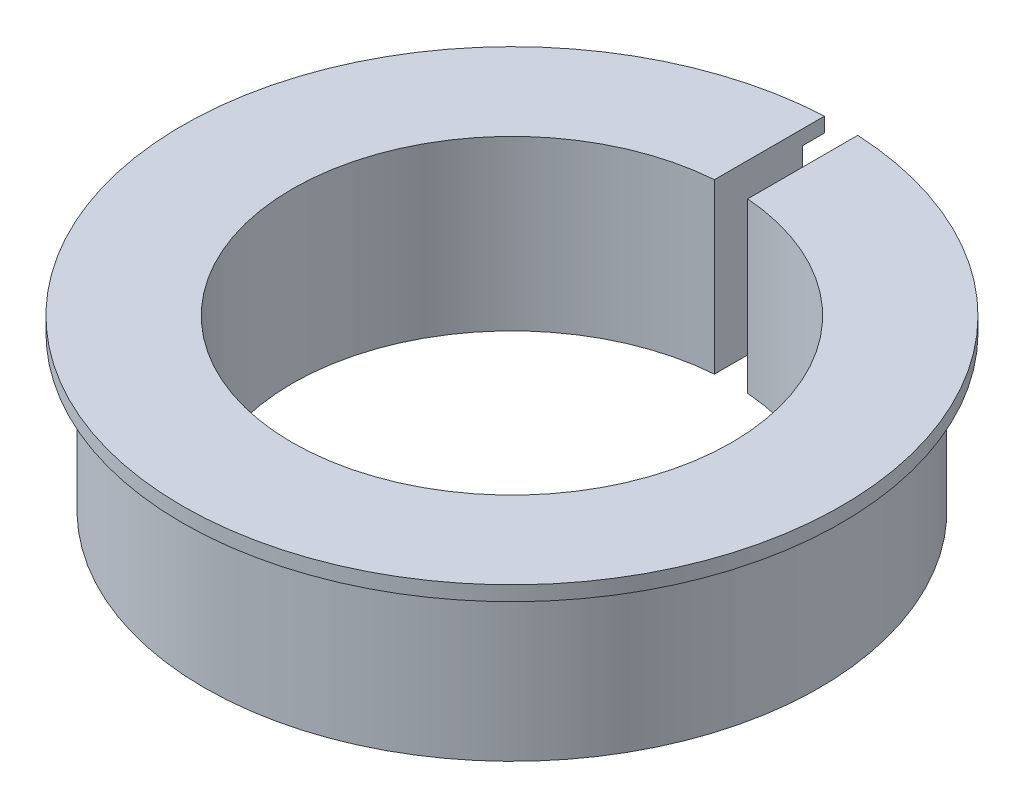
from build123d import *

# Parameters (mm, degrees)
BOSS_EXTRUDE1_DEPTH = 21
BOSS_EXTRUDE2_DEPTH = 2


with BuildPart() as part:
    # Sketch1 → Boss-Extrude1 (new body)
    with BuildSketch(Plane(origin=(0, 0, 0), x_dir=(1, 0, 0), z_dir=(0, 1, 0))):
        with BuildLine():
            Line((2.265430343, 29.914341466), (2.274223615, 29.914341466))
            Line((2.274223615, 29.914341466), (2.274223615, 41.938382264))
            ThreePointArc((2.274223615, 41.938382264), (-0.004403071, -41.999999769), (-2.265430343, 41.938858179))
            Line((-2.265430343, 41.938858179), (-2.265430343, 29.914341466))
            ThreePointArc((-2.265430343, 29.914341466), (0, -30), (2.265430343, 29.914341466))
        make_face()
    extrude(amount=BOSS_EXTRUDE1_DEPTH)

    # Boss-Extrude2: read off the stored shape, not the designer's step
    # Boss-Extrude2 outline → Boss-Extrude2 (add)
    with BuildSketch(Plane(origin=(0, 21, 0), x_dir=(1, 0, 0), z_dir=(0, 1, 0))):
        with BuildLine():
            ThreePointArc((-2.265430343, 44.942939661), (-0.004402235, -44.999999785), (2.274223615, 44.942495558))
            Line((2.274223615, 44.942495558), (2.274223325, 29.913674269))
            ThreePointArc((2.274223325, 29.913674269), (-0.004409129, -29.999999676), (-2.265430343, 29.914341466))
            Line((-2.265430343, 29.914341466), (-2.265430343, 44.942939661))
        make_face()
    extrude(amount=BOSS_EXTRUDE2_DEPTH)


solid = part.part
